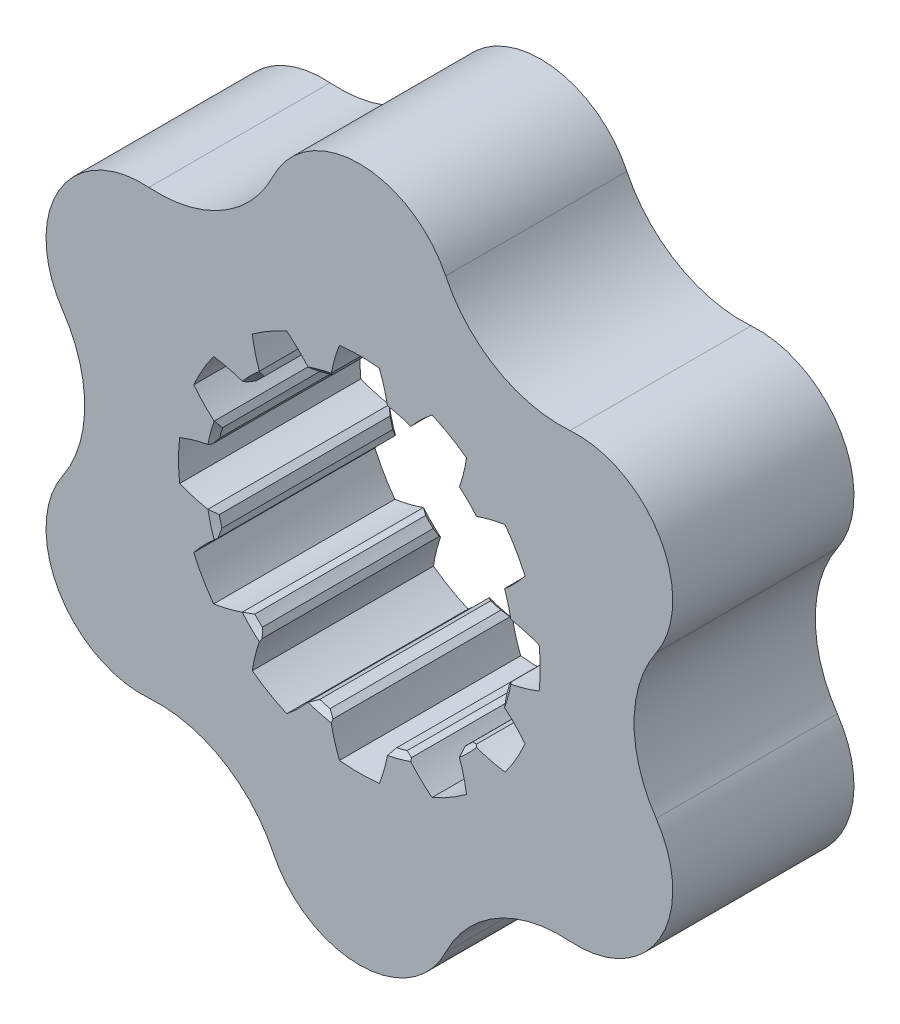
from build123d import *

# Parameters (mm, degrees)
SKETCH1_R         = 11.5
EXTRUDE1_DEPTH    = 14
CHAMFER2_SIZE     = 0.4
EXTRUDE2_REACH    = 40.741
CIRPATTERN1_COUNT = 12


with BuildPart() as part:
    # Sketch1 → Extrude1 (new body)
    with BuildSketch(Plane.XY):
        with BuildLine():
            ThreePointArc((6.664724731, 22.625811603), (0, 26.81), (-6.664724731, 22.625811603))
            ThreePointArc((-6.664724731, 22.625811603), (-10.61, 18.377059068), (-16.262165264, 17.084726727))
            ThreePointArc((-16.262165264, 17.084726727), (-23.218141075, 13.405), (-22.926889995, 5.541084875))
            ThreePointArc((-22.926889995, 5.541084875), (-21.22, 0), (-22.926889995, -5.541084875))
            ThreePointArc((-22.926889995, -5.541084875), (-23.218141075, -13.405), (-16.262165264, -17.084726727))
            ThreePointArc((-16.262165264, -17.084726727), (-10.61, -18.377059068), (-6.664724731, -22.625811603))
            ThreePointArc((-6.664724731, -22.625811603), (0, -26.81), (6.664724731, -22.625811603))
            ThreePointArc((6.664724731, -22.625811603), (10.61, -18.377059068), (16.262165264, -17.084726727))
            ThreePointArc((16.262165264, -17.084726727), (23.218141075, -13.405), (22.926889995, -5.541084875))
            ThreePointArc((22.926889995, -5.541084875), (21.22, 0), (22.926889995, 5.541084875))
            ThreePointArc((22.926889995, 5.541084875), (23.218141075, 13.405), (16.262165264, 17.084726727))
            ThreePointArc((16.262165264, 17.084726727), (10.61, 18.377059068), (6.664724731, 22.625811603))
        make_face()
        Circle(SKETCH1_R, mode=Mode.SUBTRACT)
    extrude(amount=EXTRUDE1_DEPTH)

    # Chamfer2
    chamfer2_edges = [part.edges().sort_by_distance(p)[0] for p in [
        (-11.5, 0, 0),
        (-11.5, 0, 14),
    ]]
    chamfer(chamfer2_edges, length=CHAMFER2_SIZE)

    # Sketch2 → Extrude2 (cut, up to next)
    with BuildSketch(Plane(origin=(0, 0, 0), x_dir=(-1, 0, 0), z_dir=(0, 0, -1)), mode=Mode.PRIVATE) as extrude2_sk1:
        with BuildLine():
            ThreePointArc((1.54, 13.889889308), (0, 13.975), (-1.54, 13.889889308))
            ThreePointArc((-1.54, 13.889889308), (-1.963471845, 12.604515594), (-2.24, 11.279734039))
            ThreePointArc((-2.24, 11.279734039), (0, 11.5), (2.24, 11.279734039))
            ThreePointArc((2.24, 11.279734039), (1.963471845, 12.604515594), (1.54, 13.889889308))
        make_face()
    extrude2_tool1 = extrude(extrude2_sk1.sketch, amount=-EXTRUDE2_REACH, mode=Mode.PRIVATE) & part.part
    extrude2 = extrude2_tool1.solids().sort_by_distance((0, 12.610037, 0))[0]
    add(extrude2, mode=Mode.SUBTRACT)

    # CirPattern1: Extrude2 ×12 about axis
    cirpattern1_axis = Axis((0, 0, 0), (0, 0, 1))
    for i in range(1, CIRPATTERN1_COUNT):
        add(extrude2.rotate(cirpattern1_axis, i * 360 / CIRPATTERN1_COUNT), mode=Mode.SUBTRACT)

    # Chamfer1
    # the kernel refuses this chamfer: 0.415186777, 0.25 mm, written as the material it takes off along each edge
    with BuildSketch(Plane(origin=(-10.888536226, -3.699970115, -0.719398528), x_dir=(-0.7752815640448469, -0.6316157823013736, 0), z_dir=(0, 0, 1)), Plane(origin=(-7.579763924, -8.648536226, -0.719398528), x_dir=(-0.35560563839787435, -0.9346360949265977, 0), z_dir=(0, 0, 1)), Plane(origin=(-2.24, -11.279734039, -0.719398528), x_dir=(0.15935453088175836, -0.9872214206992548, 0), z_dir=(0, 0, 1)), Plane(origin=(3.699970115, -10.888536226, -0.719398528), x_dir=(0.6316157823013886, -0.7752815640448346, 0), z_dir=(0, 0, 1)), Plane(origin=(8.648536226, -7.579763924, -0.719398528), x_dir=(0.934636094926595, -0.35560563839788134, 0), z_dir=(0, 0, 1)), Plane(origin=(11.279734039, -2.24, -0.719398528), x_dir=(0.987221420699255, 0.15935453088175663, 0), z_dir=(0, 0, 1)), Plane(origin=(10.888536226, 3.699970115, -0.719398528), x_dir=(0.7752815640448346, 0.6316157823013886, 0), z_dir=(0, 0, 1)), Plane(origin=(7.579763924, 8.648536226, -0.719398528), x_dir=(0.35560563839788134, 0.934636094926595, 0), z_dir=(0, 0, 1)), Plane(origin=(-3.699970115, 10.888536226, -0.719398528), x_dir=(-0.6316157823013728, 0.7752815640448475, 0), z_dir=(0, 0, 1)), Plane(origin=(-8.648536226, 7.579763924, -0.719398528), x_dir=(-0.9346360949265998, 0.35560563839786896, 0), z_dir=(0, 0, 1)), Plane(origin=(-11.279734039, 2.24, -0.719398528), x_dir=(-0.9872214206992548, -0.15935453088175836, 0), z_dir=(0, 0, 1))) as chamfer1_piece_1:
        with BuildLine():
            Line((0.252665365, 0), (-0.158383257, -0.402510718))
            ThreePointArc((-0.158383257, -0.402510718), (-0.080077632, -0.209054794), (0, 0))
            ThreePointArc((0, 0), (0.132268794, -0.000661418), (0.252665365, 0))
        make_face()
    extrude(amount=15.438797056, mode=Mode.SUBTRACT)
    with BuildSketch(Plane(origin=(-11.279734039, -2.24, -0.717271743), x_dir=(-0.9860090388225511, 0.16669185751028398, 0), z_dir=(0, 0, 1)), Plane(origin=(-3.699970115, -10.888536226, -0.717271743), x_dir=(-0.6373639026191948, -0.7705629472262662, 0), z_dir=(0, 0, 1)), Plane(origin=(-8.648536226, -7.579763924, -0.717271743), x_dir=(-0.9372548047365453, -0.34864513620336135, 0), z_dir=(0, 0, 1)), Plane(origin=(2.24, -11.279734039, -0.717271743), x_dir=(-0.166691857510282, -0.9860090388225514, 0), z_dir=(0, 0, 1)), Plane(origin=(7.579763924, -8.648536226, -0.717271743), x_dir=(0.3486451362033551, -0.9372548047365477, 0), z_dir=(0, 0, 1)), Plane(origin=(10.888536226, -3.699970115, -0.717271743), x_dir=(0.7705629472262642, -0.6373639026191973, 0), z_dir=(0, 0, 1)), Plane(origin=(11.279734039, 2.24, -0.717271743), x_dir=(0.986009038822552, -0.1666918575102797, 0), z_dir=(0, 0, 1)), Plane(origin=(8.648536226, 7.579763924, -0.717271743), x_dir=(0.9372548047365471, 0.3486451362033564, 0), z_dir=(0, 0, 1)), Plane(origin=(-2.24, 11.279734039, -0.717271743), x_dir=(0.16669185751027965, 0.9860090388225519, 0), z_dir=(0, 0, 1)), Plane(origin=(-7.579763924, 8.648536226, -0.717271743), x_dir=(-0.3486451362033596, 0.937254804736546, 0), z_dir=(0, 0, 1)), Plane(origin=(-10.888536226, 3.699970115, -0.717271743), x_dir=(-0.7705629472262661, 0.6373639026191952, 0), z_dir=(0, 0, 1))) as chamfer1_piece_2:
        with BuildLine():
            Line((0.431705672, 0), (-0.092473938, 0.235272698))
            ThreePointArc((-0.092473938, 0.235272698), (-0.047764497, 0.123417416), (0, 0))
            ThreePointArc((0, 0), (0.223431834, 0.00193289), (0.431705672, 0))
        make_face()
    extrude(amount=15.434543485, mode=Mode.SUBTRACT)
    with BuildSketch(Plane(origin=(3.699970115, 10.888536226, -0.717271743), x_dir=(-0.9503082620008578, 0.31131046749653124, 0), z_dir=(0, 0, 1))) as chamfer1_piece_3:
        with BuildLine():
            Line((0.252793734, 0), (-0.157921333, -0.40178432))
            ThreePointArc((-0.157921333, -0.40178432), (-0.079934202, -0.208652927), (0, 0))
            ThreePointArc((0, 0), (0.132336032, -0.000693103), (0.252793734, 0))
        make_face()
    extrude(amount=15.434543485, mode=Mode.SUBTRACT)
    with BuildSketch(Plane(origin=(2.24, 11.279734039, -0.719398528), x_dir=(0.9770097772724489, -0.2131945006655653, 0), z_dir=(0, 0, 1))) as chamfer1_piece_4:
        with BuildLine():
            Line((0.43255073, 0), (-0.092516231, 0.235118127))
            ThreePointArc((-0.092516231, 0.235118127), (-0.047816205, 0.123325106), (0, 0))
            ThreePointArc((0, 0), (0.22385756, 0.002031377), (0.43255073, 0))
        make_face()
    extrude(amount=15.438797056, mode=Mode.SUBTRACT)


solid = part.part
